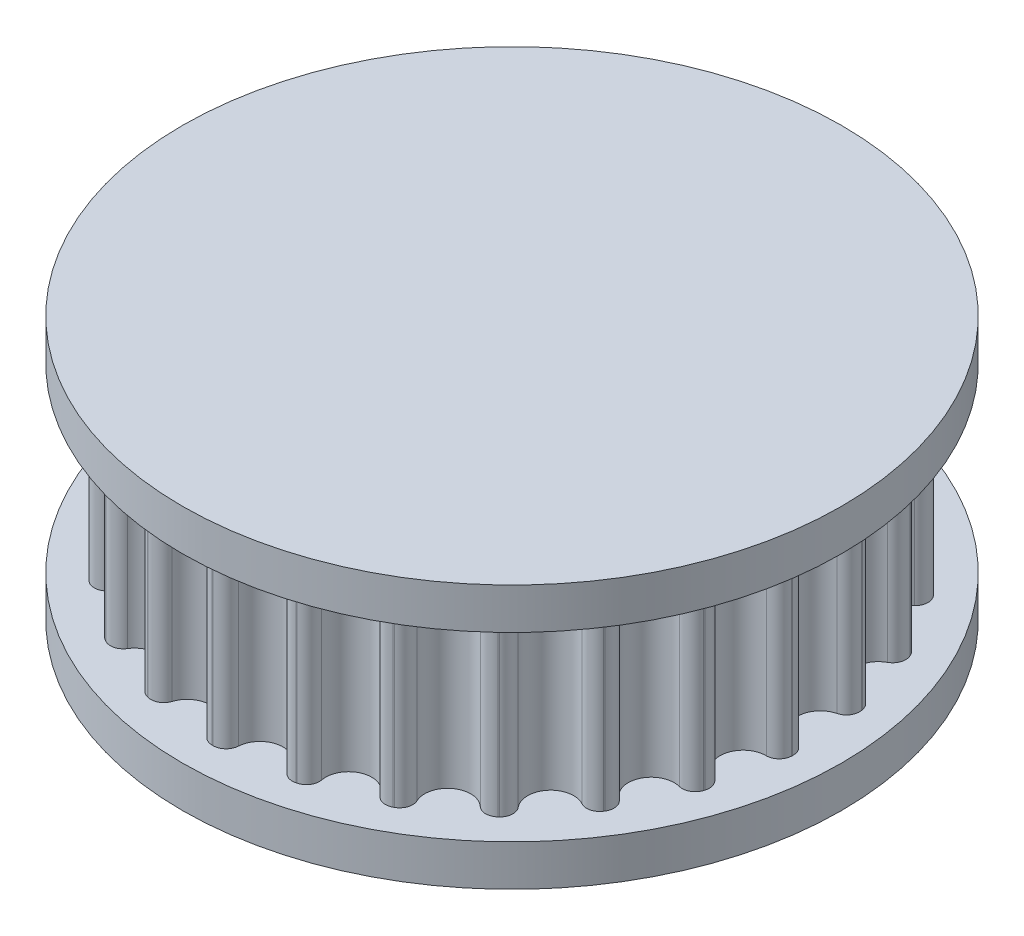
from build123d import *

# Parameters (mm, degrees)
BOSS_EXTRUDE1_DEPTH = 3.556
CIRPATTERN1_COUNT   = 25
SKETCH2_W           = 12.729724041
SKETCH2_H           = 1.5875


with BuildPart() as part:
    # Sketch1 → Boss-Extrude1 (new, symmetric)
    with BuildSketch(Plane(origin=(0, 0, 0), x_dir=(1, 0, 0), z_dir=(0, 1, 0))):
        with BuildLine():
            ThreePointArc((0.874922161, 11.061844516), (0.568733158, 10.540399187), (0, 10.334973941))
            ThreePointArc((0, 10.334973941), (-1.295315703, -10.253479585), (2.570203503, 10.01028173))
            ThreePointArc((2.570203503, 10.01028173), (2.070425324, 10.350691349), (1.903533992, 10.931900623))
            ThreePointArc((1.903533992, 10.931900623), (1.790851324, 11.282945888), (1.46818608, 11.461319938))
            ThreePointArc((1.46818608, 11.461319938), (1.44822226, 11.463859619), (1.428254048, 11.466364527))
            ThreePointArc((1.428254048, 11.466364527), (1.071366103, 11.373838008), (0.874922161, 11.061844516))
        make_face()
    boss_extrude1 = extrude(amount=BOSS_EXTRUDE1_DEPTH, both=True)

    # CirPattern1: Boss-Extrude1 ×25 about axis
    cirpattern1_axis = Axis((0, 3.3, 0), (0, -1, 0))
    for i in range(1, CIRPATTERN1_COUNT):
        add(boss_extrude1.rotate(cirpattern1_axis, i * 360 / CIRPATTERN1_COUNT))

    # Sketch2 → Revolve3 (revolve)
    with BuildSketch(Plane(origin=(0, 0, 0), x_dir=(0, 0, -1), z_dir=(1, 0, 0))):
        with Locations((6.364862021, 4.293749985)):
            Rectangle(SKETCH2_W, SKETCH2_H)
    revolve3 = revolve(axis=Axis((0, 3.3, 0), (0, -1, 0)))

    # Mirror1: Revolve3 across plane
    add(revolve3.mirror(Plane.ZX))


solid = part.part
